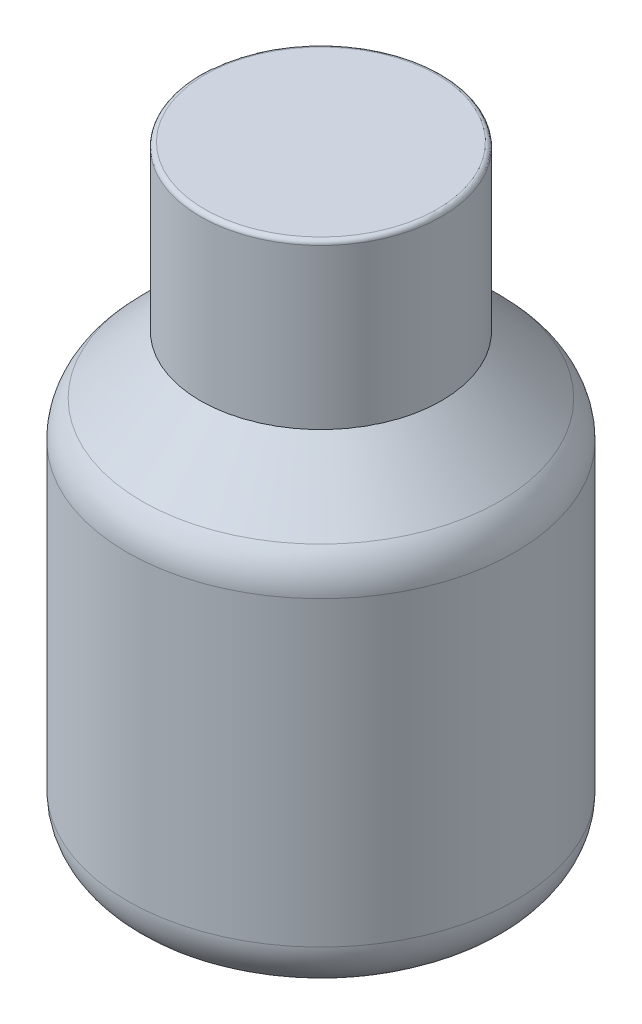
from build123d import *


with BuildPart() as part:
    # Esboço1 → Revolução1 (revolve)
    with BuildSketch(Plane.XY):
        with BuildLine():
            Line((0, 0), (-16.5, 0))
            ThreePointArc((-16.5, 0), (-20.742640687, 1.757359313), (-22.5, 6))
            Line((-22.5, 6), (-22.5, 41.014718626))
            ThreePointArc((-22.5, 41.014718626), (-22.043277195, 43.31081922), (-20.742640687, 45.257359313))
            Line((-20.742640687, 45.257359313), (-11, 55))
            Line((-11, 55), (-11, 68))
            Line((-11, 68), (-9.5, 68))
            Line((-9.5, 68), (-9.5, 70))
            Line((-9.5, 70), (0, 70))
            Line((0, 70), (0, 0))
        make_face()
    revolve(axis=Axis((0, 70, 0), (0, -1, 0)))


with BuildPart() as body_2:
    # Esboço2 → Revolução2 (revolve)
    with BuildSketch(Plane.XY):
        with BuildLine():
            Line((14, 52), (14, 70.5))
            ThreePointArc((14, 70.5), (13.853553391, 70.853553391), (13.5, 71))
            Line((13.5, 71), (0, 71))
            Line((0, 71), (0, 70))
            Line((0, 70), (13, 70))
            Line((13, 70), (13, 53))
            Line((13, 53), (14, 52))
        make_face()
    revolve(axis=Axis((0, 0, 0), (0, 1, 0)))


solid = Compound([part.part, body_2.part])
